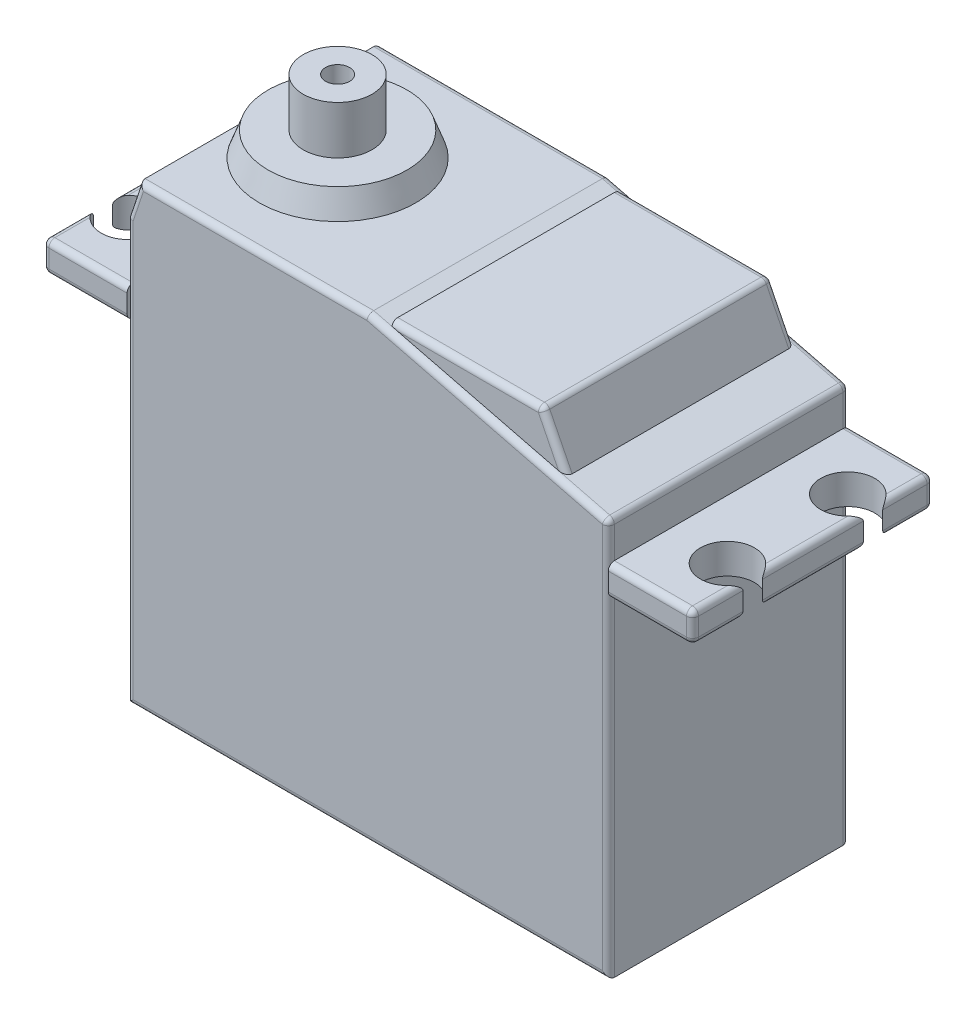
from build123d import *

# Parameters (mm, degrees)
SKETCH2_W             = 40
SKETCH2_H             = 20
BOSS_EXTRUDE1_DEPTH   = 38
SKETCH3_R             = 6.5
BOSS_EXTRUDE2_DEPTH   = 2
BOSS_EXTRUDE2_TAPER   = 20
SKETCH4_R             = 2.8575
BOSS_EXTRUDE3_DEPTH   = 4
SKETCH5_R             = 1
CUT_EXTRUDE1_DEPTH    = 5
BOSS_EXTRUDE6_START   = -8
BOSS_EXTRUDE6_DEPTH   = 2.5
BOSS_EXTRUDE6_2_DEPTH = 2.5
CUT_EXTRUDE5_DEPTH    = 68.416615163
BOSS_EXTRUDE7_START   = -0.5
BOSS_EXTRUDE7_DEPTH   = 19
FILLET1_R             = 0.5
FILLET3_R             = 0.5
FILLET4_R             = 0.5


with BuildPart() as part:
    # Sketch2 → Boss-Extrude1 (new body)
    with BuildSketch(Plane(origin=(0, 0, 0), x_dir=(1, 0, 0), z_dir=(0, 1, 0))):
        with Locations((20, 10)):
            Rectangle(SKETCH2_W, SKETCH2_H)
    extrude(amount=BOSS_EXTRUDE1_DEPTH)

    # Sketch3 → Boss-Extrude2 (add)
    with BuildSketch(Plane(origin=(0, 38, 0), x_dir=(1, 0, 0), z_dir=(0, 1, 0))):
        with Locations((7.5, 10)):
            Circle(SKETCH3_R)
    extrude(amount=BOSS_EXTRUDE2_DEPTH, taper=BOSS_EXTRUDE2_TAPER)

    # Sketch4 → Boss-Extrude3 (add)
    with BuildSketch(Plane(origin=(0, 40, 0), x_dir=(1, 0, 0), z_dir=(0, 1, 0))):
        with Locations(Location((7.5, 10, 0), (0, 0, 270))):
            Circle(SKETCH4_R)
    extrude(amount=BOSS_EXTRUDE3_DEPTH)

    # Sketch5 → Cut-Extrude1 (cut)
    with BuildSketch(Plane(origin=(0, 44, 0), x_dir=(1, 0, 0), z_dir=(0, 1, 0))):
        with Locations(Location((7.5, 10, 0), (0, 0, 270))):
            Circle(SKETCH5_R)
    extrude(amount=-CUT_EXTRUDE1_DEPTH, mode=Mode.SUBTRACT)

    # Sketch8 → Cut-Extrude5 (cut, through all)
    with BuildSketch(Plane.XY):
        Polygon((20, 38), (40, 33), (40, 38), align=None)
        Polygon((0, 38), (0, 35), (1, 38), align=None)
    extrude(amount=-CUT_EXTRUDE5_DEPTH, mode=Mode.SUBTRACT)

    # Sketch9 → Boss-Extrude7 (add)
    with BuildSketch(Plane.XY.offset(BOSS_EXTRUDE7_START)):
        Polygon((21.5, 38), (34, 38), (36, 34), (21.5, 37.625), align=None)
    extrude(amount=-BOSS_EXTRUDE7_DEPTH)

    # Fillet1
    fillet1_edges = [part.edges().sort_by_distance(p)[0] for p in [
        (30, 35.5, 0),
        (40, 16.5, 0),
        (20, 0, 0),
        (0, 17.5, 0),
        (0.5, 36.5, 0),
        (10.5, 38, 0),
        (34, 38, -10),
        (40, 33, -10),
        (27.75, 38, -19.5),
        (35, 36, -19.5),
        (35, 36, -0.5),
        (27.75, 38, -0.5),
        (0.5, 36.5, -20),
        (20, 0, -20),
        (30, 35.5, -20),
        (10.5, 38, -20),
        (0, 17.5, -20),
        (40, 16.5, -20),
    ]]
    fillet(fillet1_edges, radius=FILLET1_R - 0.0001)  # a hair under: the kernel refuses the full size


with BuildPart() as body_2:
    # Sketch6 → Boss-Extrude6 (new body)
    with BuildSketch(Plane(origin=(0, 38, 0), x_dir=(1, 0, 0), z_dir=(0, 1, 0)).offset(BOSS_EXTRUDE6_START)):
        with BuildLine():
            Line((40, 0), (47, 0))
            Line((47, 0), (47, 4.192225279))
            ThreePointArc((47, 4.192225279), (42.65, 5), (47, 5.807774721))
            Line((47, 5.807774721), (47, 14.192225279))
            ThreePointArc((47, 14.192225279), (42.65, 15), (47, 15.807774721))
            Line((47, 15.807774721), (47, 20))
            Line((47, 20), (40, 20))
            Line((40, 20), (40, 0))
        make_face()
    extrude(amount=-BOSS_EXTRUDE6_DEPTH)

    # Fillet4
    fillet4_edges = [body_2.edges().sort_by_distance(p)[0] for p in [
        (47, 27.5, -2.096112639),
        (43.5, 30, 0),
        (47, 28.75, -20),
        (47, 28.75, 0),
        (47, 27.5, -10),
        (47, 27.5, -17.903887361),
        (43.5, 27.5, -20),
        (43.5, 27.5, 0),
        (43.5, 30, -20),
        (47, 30, -17.903887361),
        (47, 30, -10),
        (47, 30, -2.096112639),
    ]]
    fillet(fillet4_edges, radius=FILLET4_R)


with BuildPart() as body_3:
    # Sketch6 → Boss-Extrude6 2 (new body)
    with BuildSketch(Plane(origin=(0, 38, 0), x_dir=(1, 0, 0), z_dir=(0, 1, 0)).offset(BOSS_EXTRUDE6_START)):
        with BuildLine():
            Line((-7, 15.807774721), (-7, 20))
            Line((-7, 20), (0, 20))
            Line((0, 20), (0, 0))
            Line((0, 0), (-7, 0))
            Line((-7, 0), (-7, 4.192225279))
            ThreePointArc((-7, 4.192225279), (-2.65, 5), (-7, 5.807774721))
            Line((-7, 5.807774721), (-7, 14.192225279))
            ThreePointArc((-7, 14.192225279), (-2.65, 15), (-7, 15.807774721))
        make_face()
    extrude(amount=-BOSS_EXTRUDE6_2_DEPTH)

    # Fillet3
    fillet3_edges = [body_3.edges().sort_by_distance(p)[0] for p in [
        (-7, 30, -10),
        (-7, 27.5, -2.096112639),
        (-7, 28.75, -20),
        (-7, 28.75, 0),
        (-3.5, 27.5, 0),
        (-3.5, 27.5, -20),
        (-7, 27.5, -17.903887361),
        (-7, 27.5, -10),
        (-7, 30, -17.903887361),
        (-3.5, 30, -20),
        (-3.5, 30, 0),
        (-7, 30, -2.096112639),
    ]]
    fillet(fillet3_edges, radius=FILLET3_R)


solid = Compound([part.part, body_2.part, body_3.part])
